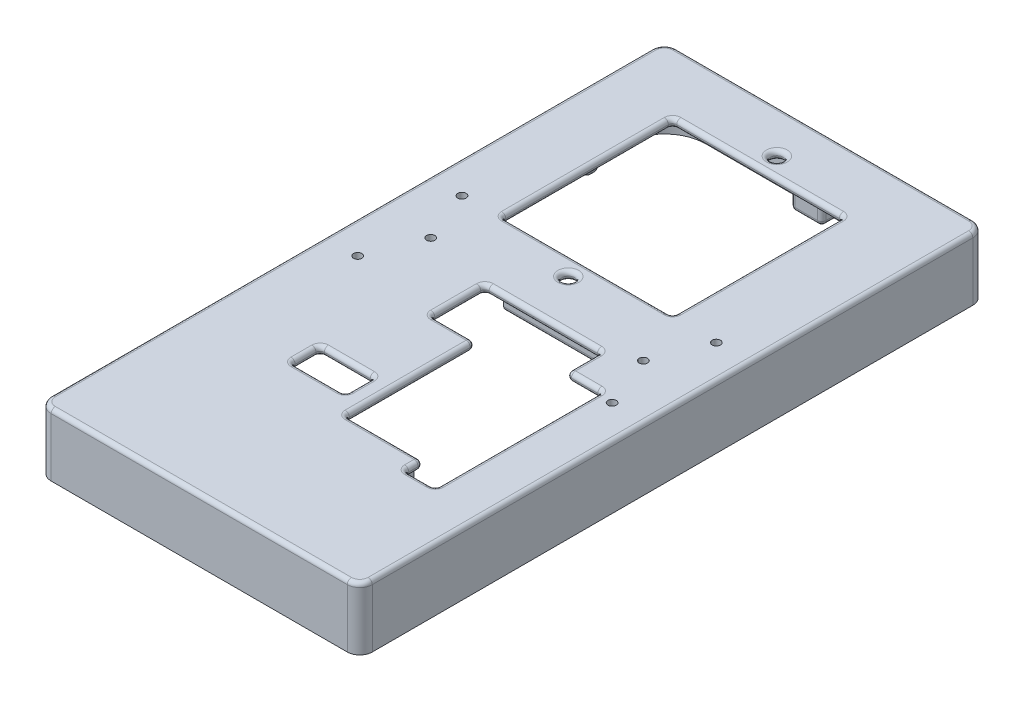
from build123d import *

# Parameters (mm, degrees)
EXTRUDE_1_DEPTH     = 15
FILLET_1_R          = 1
EXTRUDE_START       = -2
SKETCH_2_R          = 1.5
EXTRUDE_2_DEPTH     = 2
SKETCH_6_W          = 4.148468686
SKETCH_6_H          = 9
SKETCH_6_W_2        = 1
SKETCH_6_H_2        = 40
SKETCH_6_W_3        = 28
SKETCH_6_H_3        = 2.5
SKETCH_6_W_4        = 4.023279283
SKETCH_6_H_4        = 31
EXTRUDE_4_DEPTH     = 2
FILLET_7_R          = 1
CUT_EXTRUDE_3_DEPTH = 2
EXTRUDE_5_DEPTH     = 13
FILLET_2_R          = 1
FILLET_3_R          = 1
FILLET_4_R          = 1
SKETCH_3_R          = 0.95
CUT_EXTRUDE_1_DEPTH = 10
EXTRUDE_3_DEPTH     = 5
FILLET_6_R          = 1
SKETCH_5_R          = 1
CUT_EXTRUDE_2_DEPTH = 2
SKETCH_9_R          = 0.675
CUT_EXTRUDE_4_DEPTH = 10
FILLET_8_R          = 1


# Some blends are built 0.0001 mm under size
with BuildPart() as part:
    # 草图1 → 凸台-拉伸1 (new body)
    with BuildSketch(Plane(origin=(0, 0, 0), x_dir=(1, 0, 0), z_dir=(0, 1, 0))):
        with BuildLine():
            Line((-45.147424513, 1386.006364089), (-45.147424513, 1242.006364089))
            ThreePointArc((-45.147424513, 1242.006364089), (-46.02610417, 1239.885043746), (-48.147424513, 1239.006364089))
            Line((-48.147424513, 1239.006364089), (-119.147424513, 1239.006364089))
            ThreePointArc((-119.147424513, 1239.006364089), (-121.268744857, 1239.885043746), (-122.147424513, 1242.006364089))
            Line((-122.147424513, 1242.006364089), (-122.147424513, 1386.006364089))
            ThreePointArc((-122.147424513, 1386.006364089), (-121.268744857, 1388.127684433), (-119.147424513, 1389.006364089))
            Line((-119.147424513, 1389.006364089), (-48.147424513, 1389.006364089))
            ThreePointArc((-48.147424513, 1389.006364089), (-46.02610417, 1388.127684433), (-45.147424513, 1386.006364089))
        make_face()
        with BuildLine():
            Line((-110.647424513, 1387.506364089), (-86.803457574, 1387.506364089))
            Line((-86.803457574, 1387.506364089), (-86.803457574, 1384.006364089))
            Line((-86.803457574, 1384.006364089), (-79.369983761, 1384.006364089))
            Line((-79.369983761, 1384.006364089), (-79.369983761, 1387.506364089))
            Line((-79.369983761, 1387.506364089), (-56.647424513, 1387.506364089))
            ThreePointArc((-56.647424513, 1387.506364089), (-49.576356701, 1384.577431901), (-46.647424513, 1377.506364089))
            Line((-46.647424513, 1377.506364089), (-46.647424513, 1369.006364089))
            Line((-46.647424513, 1369.006364089), (-49.647424513, 1369.006364089))
            Line((-49.647424513, 1369.006364089), (-49.647424513, 1366.006364089))
            Line((-49.647424513, 1366.006364089), (-46.647424513, 1366.006364089))
            Line((-46.647424513, 1366.006364089), (-46.647424513, 1262.006364089))
            Line((-46.647424513, 1262.006364089), (-49.647424513, 1262.006364089))
            Line((-49.647424513, 1262.006364089), (-49.647424513, 1259.006364089))
            Line((-49.647424513, 1259.006364089), (-46.647424513, 1259.006364089))
            Line((-46.647424513, 1259.006364089), (-46.647424513, 1250.506364089))
            ThreePointArc((-46.647424513, 1250.506364089), (-49.576356701, 1243.435296277), (-56.647424513, 1240.506364089))
            Line((-56.647424513, 1240.506364089), (-80.788236334, 1240.506364089))
            Line((-80.788236334, 1240.506364089), (-80.788236334, 1243.506364089))
            Line((-80.788236334, 1243.506364089), (-86.803457574, 1243.506364089))
            Line((-86.803457574, 1243.506364089), (-86.803457574, 1240.506364089))
            Line((-86.803457574, 1240.506364089), (-110.647424513, 1240.506364089))
            ThreePointArc((-110.647424513, 1240.506364089), (-117.718492325, 1243.435296277), (-120.647424513, 1250.506364089))
            Line((-120.647424513, 1250.506364089), (-120.647424513, 1259.006364089))
            Line((-120.647424513, 1259.006364089), (-117.647424513, 1259.006364089))
            Line((-117.647424513, 1259.006364089), (-117.647424513, 1262.006364089))
            Line((-117.647424513, 1262.006364089), (-120.647424513, 1262.006364089))
            Line((-120.647424513, 1262.006364089), (-120.647424513, 1366.006364089))
            Line((-120.647424513, 1366.006364089), (-117.647424513, 1366.006364089))
            Line((-117.647424513, 1366.006364089), (-117.647424513, 1369.006364089))
            Line((-117.647424513, 1369.006364089), (-120.647424513, 1369.006364089))
            Line((-120.647424513, 1369.006364089), (-120.647424513, 1377.506364089))
            ThreePointArc((-120.647424513, 1377.506364089), (-117.718492325, 1384.577431901), (-110.647424513, 1387.506364089))
        make_face(mode=Mode.SUBTRACT)
    extrude(amount=EXTRUDE_1_DEPTH)

    # 圆角1
    fillet_1_edges = [part.edges().sort_by_distance(p)[0] for p in [
        (-49.647424513, 7.5, -1259.006364089),
        (-49.647424513, 7.5, -1262.006364089),
        (-49.647424513, 7.5, -1366.006364089),
        (-49.647424513, 7.5, -1369.006364089),
        (-79.369983761, 7.5, -1384.006364089),
        (-86.803457574, 7.5, -1384.006364089),
        (-117.647424513, 7.5, -1369.006364089),
        (-117.647424513, 7.5, -1366.006364089),
        (-117.647424513, 7.5, -1262.006364089),
        (-117.647424513, 7.5, -1259.006364089),
        (-86.803457574, 7.5, -1243.506364089),
        (-80.788236334, 7.5, -1243.506364089),
    ]]
    fillet(fillet_1_edges, radius=FILLET_1_R)

    # 草图2 → 凸台-拉伸2 (add)
    with BuildSketch(Plane(origin=(0, 15, 0), x_dir=(1, 0, 0), z_dir=(0, 1, 0)).offset(EXTRUDE_START)):
        with BuildLine():
            Line((-45.147424513, 1242.006364089), (-45.147424513, 1386.006364089))
            ThreePointArc((-45.147424513, 1386.006364089), (-46.02610417, 1388.127684433), (-48.147424513, 1389.006364089))
            Line((-48.147424513, 1389.006364089), (-119.147424513, 1389.006364089))
            ThreePointArc((-119.147424513, 1389.006364089), (-121.268744857, 1388.127684433), (-122.147424513, 1386.006364089))
            Line((-122.147424513, 1386.006364089), (-122.147424513, 1242.006364089))
            ThreePointArc((-122.147424513, 1242.006364089), (-121.268744857, 1239.885043746), (-119.147424513, 1239.006364089))
            Line((-119.147424513, 1239.006364089), (-48.147424513, 1239.006364089))
            ThreePointArc((-48.147424513, 1239.006364089), (-46.02610417, 1239.885043746), (-45.147424513, 1242.006364089))
        make_face()
        with Locations(Location((-84.647424513, 1378.506364089, 0), (0, 0, 270))):
            Circle(SKETCH_2_R, mode=Mode.SUBTRACT)
        with Locations(Location((-84.647424513, 1328.506364089, 0), (0, 0, 270))):
            Circle(SKETCH_2_R, mode=Mode.SUBTRACT)
        with BuildLine():
            Line((-65.147424513, 1308.756575121), (-65.147424513, 1318.506364089))
            ThreePointArc((-65.147424513, 1318.506364089), (-65.440317732, 1319.21347087), (-66.147424513, 1319.506364089))
            Line((-66.147424513, 1319.506364089), (-92.147424513, 1319.506364089))
            ThreePointArc((-92.147424513, 1319.506364089), (-92.854531294, 1319.21347087), (-93.147424513, 1318.506364089))
            Line((-93.147424513, 1318.506364089), (-93.147424513, 1313.006364089))
            ThreePointArc((-93.147424513, 1313.006364089), (-93.440317732, 1312.299257308), (-94.147424513, 1312.006364089))
            Line((-94.147424513, 1312.006364089), (-95.147424513, 1312.006364089))
            ThreePointArc((-95.147424513, 1312.006364089), (-95.854531294, 1311.71347087), (-96.147424513, 1311.006364089))
            Line((-96.147424513, 1311.006364089), (-96.147424513, 1305.006364089))
            ThreePointArc((-96.147424513, 1305.006364089), (-95.854531294, 1304.299257308), (-95.147424513, 1304.006364089))
            Line((-95.147424513, 1304.006364089), (-86.147424513, 1304.006364089))
            ThreePointArc((-86.147424513, 1304.006364089), (-85.440317732, 1303.71347087), (-85.147424513, 1303.006364089))
            Line((-85.147424513, 1303.006364089), (-85.147424513, 1274.006364089))
            ThreePointArc((-85.147424513, 1274.006364089), (-84.854531294, 1273.299257308), (-84.147424513, 1273.006364089))
            Line((-84.147424513, 1273.006364089), (-65.147424513, 1273.006364089))
            Line((-65.147424513, 1273.006364089), (-64.147424513, 1273.006364089))
            Line((-64.147424513, 1273.006364089), (-64.147424513, 1269.756575121))
            ThreePointArc((-64.147424513, 1269.756575121), (-63.854531294, 1269.04946834), (-63.147424513, 1268.756575121))
            Line((-63.147424513, 1268.756575121), (-56.817685319, 1268.756575121))
            ThreePointArc((-56.817685319, 1268.756575121), (-56.110578538, 1269.04946834), (-55.817685319, 1269.756575121))
            Line((-55.817685319, 1269.756575121), (-55.817685319, 1308.756575121))
            Line((-55.817685319, 1308.756575121), (-65.147424513, 1308.756575121))
        make_face(mode=Mode.SUBTRACT)
        with BuildLine():
            Line((-89.147424513, 1277.506364089), (-99.147424513, 1277.506364089))
            ThreePointArc((-99.147424513, 1277.506364089), (-99.854531294, 1277.799257308), (-100.147424513, 1278.506364089))
            Line((-100.147424513, 1278.506364089), (-100.147424513, 1283.506364089))
            ThreePointArc((-100.147424513, 1283.506364089), (-99.854531294, 1284.21347087), (-99.147424513, 1284.506364089))
            Line((-99.147424513, 1284.506364089), (-89.147424513, 1284.506364089))
            ThreePointArc((-89.147424513, 1284.506364089), (-88.440317732, 1284.21347087), (-88.147424513, 1283.506364089))
            Line((-88.147424513, 1283.506364089), (-88.147424513, 1278.506364089))
            ThreePointArc((-88.147424513, 1278.506364089), (-88.440317732, 1277.799257308), (-89.147424513, 1277.506364089))
        make_face(mode=Mode.SUBTRACT)
        with BuildLine():
            Line((-104.147424513, 1374.006364089), (-65.147424513, 1374.006364089))
            ThreePointArc((-65.147424513, 1374.006364089), (-64.440317732, 1373.71347087), (-64.147424513, 1373.006364089))
            Line((-64.147424513, 1373.006364089), (-64.147424513, 1334.006364089))
            ThreePointArc((-64.147424513, 1334.006364089), (-64.440317732, 1333.299257308), (-65.147424513, 1333.006364089))
            Line((-65.147424513, 1333.006364089), (-104.147424513, 1333.006364089))
            ThreePointArc((-104.147424513, 1333.006364089), (-104.854531294, 1333.299257308), (-105.147424513, 1334.006364089))
            Line((-105.147424513, 1334.006364089), (-105.147424513, 1373.006364089))
            ThreePointArc((-105.147424513, 1373.006364089), (-104.854531294, 1373.71347087), (-104.147424513, 1374.006364089))
        make_face(mode=Mode.SUBTRACT)
    extrude(amount=EXTRUDE_2_DEPTH)

    # 草图6 → 凸台-拉伸4 (add)
    with BuildSketch(Plane(origin=(0, 15, 0), x_dir=(1, 0, 0), z_dir=(0, 1, 0))):
        with Locations((-95.221658856, 1308.506364089)):
            Rectangle(SKETCH_6_W, SKETCH_6_H)
        with Locations((-56.317685319, 1288.756575121)):
            Rectangle(SKETCH_6_W_2, SKETCH_6_H_2)
        with Locations((-79.147424513, 1318.256364089)):
            Rectangle(SKETCH_6_W_3, SKETCH_6_H_3)
        with Locations((-84.659064155, 1288.506364089)):
            Rectangle(SKETCH_6_W_4, SKETCH_6_H_4)
    extrude(amount=-EXTRUDE_4_DEPTH)

    # 圆角7
    fillet_7_edges = [part.edges().sort_by_distance(p)[0] for p in [
        (-64.147424513, 14, -1273.006364089),
        (-65.147424513, 14, -1308.756575121),
        (-56.817685319, 14, -1268.756575121),
        (-93.147424513, 14, -1304.006364089),
        (-56.817685319, 14, -1308.756575121),
        (-93.147424513, 14, -1317.006364089),
        (-65.147424513, 14, -1317.006364089),
        (-82.647424513, 14, -1273.006364089),
        (-82.647424513, 14, -1304.006364089),
    ]]
    fillet(fillet_7_edges, radius=FILLET_7_R)

    # 草图7 → 切除-拉伸3 (cut)
    with BuildSketch(Plane(origin=(0, 15, 0), x_dir=(1, 0, 0), z_dir=(0, 1, 0))):
        with BuildLine():
            Line((-89.147424513, 1284.506364089), (-88.147424513, 1284.506364089))
            ThreePointArc((-88.147424513, 1284.506364089), (-87.440317732, 1284.21347087), (-87.147424513, 1283.506364089))
            Line((-87.147424513, 1283.506364089), (-87.147424513, 1278.506364089))
            ThreePointArc((-87.147424513, 1278.506364089), (-87.440317732, 1277.799257308), (-88.147424513, 1277.506364089))
            Line((-88.147424513, 1277.506364089), (-89.147424513, 1277.506364089))
            Line((-89.147424513, 1277.506364089), (-89.147424513, 1284.506364089))
        make_face()
    extrude(amount=-CUT_EXTRUDE_3_DEPTH, mode=Mode.SUBTRACT)

    # 草图8 → 凸台-拉伸5 (add)
    with BuildSketch(Plane.XZ.offset(-13)):
        with BuildLine():
            Line((-48.647424513, -1315.506364089), (-46.647424513, -1315.506364089))
            Line((-46.647424513, -1315.506364089), (-46.647424513, -1312.506364089))
            Line((-46.647424513, -1312.506364089), (-48.647424513, -1312.506364089))
            ThreePointArc((-48.647424513, -1312.506364089), (-49.354531294, -1312.799257308), (-49.647424513, -1313.506364089))
            Line((-49.647424513, -1313.506364089), (-49.647424513, -1314.506364089))
            ThreePointArc((-49.647424513, -1314.506364089), (-49.354531294, -1315.21347087), (-48.647424513, -1315.506364089))
        make_face()
        with BuildLine():
            Line((-120.647424513, -1312.506364089), (-118.647424513, -1312.506364089))
            ThreePointArc((-118.647424513, -1312.506364089), (-117.940317732, -1312.799257308), (-117.647424513, -1313.506364089))
            Line((-117.647424513, -1313.506364089), (-117.647424513, -1314.506364089))
            ThreePointArc((-117.647424513, -1314.506364089), (-117.940317732, -1315.21347087), (-118.647424513, -1315.506364089))
            Line((-118.647424513, -1315.506364089), (-120.647424513, -1315.506364089))
            Line((-120.647424513, -1315.506364089), (-120.647424513, -1312.506364089))
        make_face()
    extrude(amount=EXTRUDE_5_DEPTH)

    # 圆角2
    fillet_2_edges = [part.edges().sort_by_distance(p)[0] for p in [
        (-46.02610417, 15, -1388.127684433),
        (-83.647424513, 15, -1389.006364089),
        (-121.268744857, 15, -1388.127684433),
        (-122.147424513, 15, -1314.006364089),
        (-121.268744857, 15, -1239.885043746),
        (-83.647424513, 15, -1239.006364089),
        (-63.854531294, 15, -1269.04946834),
        (-60.482554916, 15, -1268.756575121),
        (-93.647424513, 15, -1277.506364089),
        (-99.854531294, 15, -1277.799257308),
        (-100.147424513, 15, -1281.006364089),
        (-99.854531294, 15, -1284.21347087),
        (-93.647424513, 15, -1284.506364089),
        (-64.440317732, 15, -1333.299257308),
        (-84.647424513, 15, -1333.006364089),
        (-104.854531294, 15, -1333.299257308),
        (-105.147424513, 15, -1353.506364089),
        (-104.854531294, 15, -1373.71347087),
        (-84.647424513, 15, -1374.006364089),
        (-64.440317732, 15, -1373.71347087),
        (-64.147424513, 15, -1353.506364089),
        (-84.647424513, 15, -1380.006364089),
        (-84.647424513, 15, -1330.006364089),
        (-46.02610417, 15, -1239.885043746),
        (-93.147424513, 15, -1310.506364089),
        (-79.147424513, 15, -1317.006364089),
        (-87.897424513, 15, -1304.006364089),
        (-82.647424513, 15, -1288.506364089),
        (-65.147424513, 15, -1312.881469605),
        (-60.982554916, 15, -1308.756575121),
        (-56.817685319, 15, -1288.756575121),
        (-64.147424513, 15, -1270.881469605),
        (-73.397424513, 15, -1273.006364089),
        (-92.854531294, 15, -1316.71347087),
        (-92.854531294, 15, -1304.299257308),
        (-82.354531294, 15, -1273.299257308),
        (-57.110578538, 15, -1269.04946834),
        (-57.110578538, 15, -1308.463681902),
        (-65.440317732, 15, -1316.71347087),
        (-87.440317732, 15, -1277.799257308),
        (-87.147424513, 15, -1281.006364089),
        (-87.440317732, 15, -1284.21347087),
        (-45.147424513, 15, -1314.006364089),
        (-64.854531294, 15, -1309.04946834),
        (-64.440317732, 15, -1272.71347087),
        (-82.940317732, 15, -1303.71347087),
    ]]
    fillet(fillet_2_edges, radius=FILLET_2_R)

    # 圆角3
    fillet_3_edges = [part.edges().sort_by_distance(p)[0] for p in [
        (-49.647424513, 0, -1260.506364089),
        (-47.647424513, 0, -1262.006364089),
        (-49.647424513, 0, -1367.506364089),
        (-47.647424513, 0, -1369.006364089),
        (-83.086720668, 0, -1384.006364089),
        (-86.803457574, 0, -1386.256364089),
        (-117.647424513, 0, -1367.506364089),
        (-119.647424513, 0, -1366.006364089),
        (-117.647424513, 0, -1260.506364089),
        (-119.647424513, 0, -1259.006364089),
        (-117.940317732, 0, -1368.71347087),
        (-117.940317732, 0, -1366.299257308),
        (-49.354531294, 0, -1368.71347087),
        (-49.354531294, 0, -1366.299257308),
        (-49.354531294, 0, -1261.71347087),
        (-49.354531294, 0, -1259.299257308),
        (-117.940317732, 0, -1261.71347087),
        (-117.940317732, 0, -1259.299257308),
        (-86.510564355, 0, -1384.299257308),
        (-79.66287698, 0, -1384.299257308),
        (-47.647424513, 0, -1259.006364089),
        (-47.647424513, 0, -1366.006364089),
        (-79.369983761, 0, -1386.256364089),
        (-119.647424513, 0, -1369.006364089),
        (-119.647424513, 0, -1262.006364089),
    ]]
    fillet(fillet_3_edges, radius=FILLET_3_R)

    # 圆角4
    fillet_4_edges = [part.edges().sort_by_distance(p)[0] for p in [
        (-73.397424513, 13, -1273.006364089),
        (-87.897424513, 13, -1304.006364089),
        (-93.147424513, 13, -1310.506364089),
        (-65.147424513, 13, -1312.881469605),
        (-93.647424513, 13, -1277.506364089),
        (-99.854531294, 13, -1277.799257308),
        (-100.147424513, 13, -1281.006364089),
        (-99.854531294, 13, -1284.21347087),
        (-93.647424513, 13, -1284.506364089),
        (-86.510564355, 13, -1243.21347087),
        (-83.795846954, 13, -1243.506364089),
        (-81.081129553, 13, -1243.21347087),
        (-80.788236334, 13, -1241.506364089),
        (-68.717830424, 13, -1240.506364089),
        (-49.576356701, 13, -1243.435296277),
        (-46.647424513, 13, -1254.756364089),
        (-47.647424513, 13, -1259.006364089),
        (-49.354531294, 13, -1259.299257308),
        (-49.647424513, 13, -1260.506364089),
        (-49.354531294, 13, -1261.71347087),
        (-47.647424513, 13, -1262.006364089),
        (-46.647424513, 13, -1287.256364089),
        (-46.647424513, 13, -1340.756364089),
        (-47.647424513, 13, -1366.006364089),
        (-49.354531294, 13, -1366.299257308),
        (-49.647424513, 13, -1367.506364089),
        (-49.354531294, 13, -1368.71347087),
        (-47.647424513, 13, -1369.006364089),
        (-46.647424513, 13, -1373.256364089),
        (-49.576356701, 13, -1384.577431901),
        (-68.008704137, 13, -1387.506364089),
        (-79.369983761, 13, -1386.256364089),
        (-79.66287698, 13, -1384.299257308),
        (-83.086720668, 13, -1384.006364089),
        (-86.510564355, 13, -1384.299257308),
        (-86.803457574, 13, -1386.256364089),
        (-98.725441044, 13, -1387.506364089),
        (-117.718492325, 13, -1384.577431901),
        (-120.647424513, 13, -1373.256364089),
        (-119.647424513, 13, -1369.006364089),
        (-117.940317732, 13, -1368.71347087),
        (-117.647424513, 13, -1367.506364089),
        (-117.940317732, 13, -1366.299257308),
        (-119.647424513, 13, -1366.006364089),
        (-120.647424513, 13, -1340.756364089),
        (-120.647424513, 13, -1287.256364089),
        (-119.647424513, 13, -1262.006364089),
        (-117.940317732, 13, -1261.71347087),
        (-117.647424513, 13, -1260.506364089),
        (-117.940317732, 13, -1259.299257308),
        (-119.647424513, 13, -1259.006364089),
        (-120.647424513, 13, -1254.756364089),
        (-117.718492325, 13, -1243.435296277),
        (-98.725441044, 13, -1240.506364089),
        (-86.803457574, 13, -1241.506364089),
        (-104.854531294, 13, -1333.299257308),
        (-105.147424513, 13, -1353.506364089),
        (-104.854531294, 13, -1373.71347087),
        (-84.647424513, 13, -1374.006364089),
        (-64.440317732, 13, -1373.71347087),
        (-64.147424513, 13, -1353.506364089),
        (-64.440317732, 13, -1333.299257308),
        (-84.647424513, 13, -1333.006364089),
        (-84.647424513, 13, -1380.006364089),
        (-84.647424513, 13, -1330.006364089),
        (-60.982554916, 13, -1308.756575121),
        (-60.482554916, 13, -1268.756575121),
        (-63.854531294, 13, -1269.04946834),
        (-64.147424513, 13, -1270.881469605),
        (-82.647424513, 13, -1288.506364089),
        (-79.147424513, 13, -1317.006364089),
        (-56.817685319, 13, -1288.756575121),
        (-87.147424513, 13, -1281.006364089),
        (-87.440317732, 13, -1277.799257308),
        (-87.440317732, 13, -1284.21347087),
        (-92.854531294, 13, -1304.299257308),
        (-92.854531294, 13, -1316.71347087),
        (-65.440317732, 13, -1316.71347087),
        (-64.854531294, 13, -1309.04946834),
        (-57.110578538, 13, -1308.463681902),
        (-57.110578538, 13, -1269.04946834),
        (-64.440317732, 13, -1272.71347087),
        (-82.354531294, 13, -1273.299257308),
        (-82.940317732, 13, -1303.71347087),
        (-47.647424513, 13, -1312.506364089),
        (-49.354531294, 13, -1312.799257308),
        (-49.647424513, 13, -1314.006364089),
        (-49.354531294, 13, -1315.21347087),
        (-47.647424513, 13, -1315.506364089),
        (-119.647424513, 13, -1315.506364089),
        (-117.940317732, 13, -1315.21347087),
        (-117.647424513, 13, -1314.006364089),
        (-117.940317732, 13, -1312.799257308),
        (-119.647424513, 13, -1312.506364089),
    ]]
    fillet(fillet_4_edges, radius=FILLET_4_R - 0.0001)  # a hair under: the kernel refuses the full size

    # 草图3 → 切除-拉伸1 (cut)
    with BuildSketch(Plane.XZ):
        with Locations(Location((-47.647424513, -1241.506364089, 0), (0, 0, 270))):
            Circle(SKETCH_3_R)
        with Locations(Location((-47.647424513, -1386.506364089, 0), (0, 0, 90))):
            Circle(SKETCH_3_R)
        with Locations(Location((-119.647424513, -1386.506364089, 0), (0, 0, 270))):
            Circle(SKETCH_3_R)
        with Locations(Location((-119.647424513, -1241.506364089, 0), (0, 0, 90))):
            Circle(SKETCH_3_R)
    extrude(amount=-CUT_EXTRUDE_1_DEPTH, mode=Mode.SUBTRACT)

    # 草图4 → 凸台-拉伸3 (add)
    with BuildSketch(Plane.XZ.offset(-13)):
        with BuildLine():
            Line((-65.147424513, -1272.006364089), (-84.189709335, -1272.006364089))
            Line((-84.189709335, -1272.006364089), (-84.189709335, -1270.363580133))
            ThreePointArc((-84.189709335, -1270.363580133), (-83.896816117, -1269.656473352), (-83.189709335, -1269.363580133))
            Line((-83.189709335, -1269.363580133), (-65.147424513, -1269.363580133))
            Line((-65.147424513, -1269.363580133), (-65.147424513, -1272.006364089))
        make_face()
        with BuildLine():
            Line((-92.147424513, -1320.506364089), (-66.038217179, -1320.506364089))
            Line((-66.038217179, -1320.506364089), (-66.038217179, -1323.506364089))
            ThreePointArc((-66.038217179, -1323.506364089), (-66.331110398, -1324.21347087), (-67.038217179, -1324.506364089))
            Line((-67.038217179, -1324.506364089), (-91.147424513, -1324.506364089))
            ThreePointArc((-91.147424513, -1324.506364089), (-91.854531294, -1324.21347087), (-92.147424513, -1323.506364089))
            Line((-92.147424513, -1323.506364089), (-92.147424513, -1320.506364089))
        make_face()
        with BuildLine():
            Line((-108.48607648, -1336.761605055), (-111.798345351, -1336.761605055))
            ThreePointArc((-111.798345351, -1336.761605055), (-112.505452132, -1336.468711836), (-112.798345351, -1335.761605055))
            Line((-112.798345351, -1335.761605055), (-112.798345351, -1333.761605055))
            ThreePointArc((-112.798345351, -1333.761605055), (-112.505452132, -1333.054498274), (-111.798345351, -1332.761605055))
            Line((-111.798345351, -1332.761605055), (-108.48607648, -1332.761605055))
            ThreePointArc((-108.48607648, -1332.761605055), (-107.778969698, -1333.054498274), (-107.48607648, -1333.761605055))
            Line((-107.48607648, -1333.761605055), (-107.48607648, -1335.761605055))
            ThreePointArc((-107.48607648, -1335.761605055), (-107.778969698, -1336.468711836), (-108.48607648, -1336.761605055))
        make_face()
    extrude(amount=EXTRUDE_3_DEPTH)

    # 圆角6
    fillet_6_edges = [part.edges().sort_by_distance(p)[0] for p in [
        (-92.147424513, 8, -1322.006364089),
        (-91.854531294, 8, -1324.21347087),
        (-79.092820846, 8, -1324.506364089),
        (-66.331110398, 8, -1324.21347087),
        (-66.038217179, 8, -1322.006364089),
        (-79.092820846, 8, -1320.506364089),
    ]]
    fillet(fillet_6_edges, radius=FILLET_6_R)

    # 草图5 → 切除-拉伸2 (cut)
    with BuildSketch(Plane(origin=(0, 15, 0), x_dir=(1, 0, 0), z_dir=(0, 1, 0))):
        with Locations(Location((-58.147424513, 1320.006364089, 0), (0, 0, 270))):
            Circle(SKETCH_5_R)
        with Locations(Location((-53.147424513, 1307.506364089, 0), (0, 0, 270))):
            Circle(SKETCH_5_R)
        with Locations(Location((-53.147424513, 1332.506364089, 0), (0, 0, 270))):
            Circle(SKETCH_5_R)
        with Locations(Location((-114.147424513, 1332.506364089, 0), (0, 0, 270))):
            Circle(SKETCH_5_R)
        with Locations(Location((-114.147424513, 1307.506364089, 0), (0, 0, 270))):
            Circle(SKETCH_5_R)
        with Locations(Location((-109.147424513, 1320.006364089, 0), (0, 0, 270))):
            Circle(SKETCH_5_R)
    extrude(amount=-CUT_EXTRUDE_2_DEPTH, mode=Mode.SUBTRACT)

    # 草图9 → 切除-拉伸4 (cut)
    with BuildSketch(Plane.XZ):
        with Locations(Location((-47.147424513, -1314.031879868, 0), (0, 0, 270))):
            Circle(SKETCH_9_R)
        with Locations(Location((-120.147424513, -1314.031879868, 0), (0, 0, 90))):
            Circle(SKETCH_9_R)
    extrude(amount=-CUT_EXTRUDE_4_DEPTH, mode=Mode.SUBTRACT)

    # 圆角8
    # the kernel refuses this fillet: 1 mm, written as the material it adds along each edge
    with BuildSketch(Plane(origin=(-47.647424513, 13, -1316.506364089), x_dir=(0, 0, 1), z_dir=(-1, 0, 0))) as fillet_8_piece_1:
        with BuildLine():
            CenterArc((0.0001, -0.9999), 0.9999, 0, 90)
            Line((1, -0.9999), (1, 0))
            Line((1, 0), (0.0001, 0))
        make_face()
    revolve(axis=Axis((-47.647424513, 13, -1316.506364089), (0, 1, 0)), revolution_arc=90)
    with BuildSketch(Plane(origin=(-47.647424513, 13, -1311.506364089), x_dir=(1, 0, 0), z_dir=(0, 0, 1))) as fillet_8_piece_2:
        with BuildLine():
            CenterArc((0.0001, -0.9999), 0.9999, 0, 90)
            Line((1, -0.9999), (1, 0))
            Line((1, 0), (0.0001, 0))
        make_face()
    revolve(axis=Axis((-47.647424513, 13, -1311.506364089), (0, 1, 0)), revolution_arc=90)
    with BuildSketch(Plane(origin=(-119.647424513, 13, -1316.506364089), x_dir=(-1, 0, 0), z_dir=(0, 0, -1))) as fillet_8_piece_3:
        with BuildLine():
            CenterArc((0.0001, -0.9999), 0.9999, 0, 90)
            Line((1, -0.9999), (1, 0))
            Line((1, 0), (0.0001, 0))
        make_face()
    revolve(axis=Axis((-119.647424513, 13, -1316.506364089), (0, 1, 0)), revolution_arc=90)
    with BuildSketch(Plane(origin=(-119.647424513, 13, -1311.506364089), x_dir=(0, 0, -1), z_dir=(1, 0, 0))) as fillet_8_piece_4:
        with BuildLine():
            CenterArc((0.0001, -0.9999), 0.9999, 0, 90)
            Line((1, -0.9999), (1, 0))
            Line((1, 0), (0.0001, 0))
        make_face()
    revolve(axis=Axis((-119.647424513, 13, -1311.506364089), (0, 1, 0)), revolution_arc=90)
    with BuildSketch(Plane(origin=(-46.647424513, 13, -1315.506364089), x_dir=(-1, 0, 0), z_dir=(0, -1, 0)), Plane(origin=(-46.647424513, 13, -1312.506364089), x_dir=(0, 0, 1), z_dir=(0, -1, 0))) as fillet_8_piece_5:
        with BuildLine():
            CenterArc((FILLET_8_R, FILLET_8_R), FILLET_8_R, 180, 90)
            Line((0, FILLET_8_R), (0, 0))
            Line((0, 0), (FILLET_8_R, 0))
        make_face()
    extrude(amount=13)
    with BuildSketch(Plane(origin=(-120.647424513, 13, -1312.506364089), x_dir=(0, 0, 1), z_dir=(0, -1, 0)), Plane(origin=(-120.647424513, 13, -1315.506364089), x_dir=(1, 0, 0), z_dir=(0, -1, 0))) as fillet_8_piece_6:
        with BuildLine():
            CenterArc((FILLET_8_R, -FILLET_8_R), FILLET_8_R, 90, 90)
            Line((0, -FILLET_8_R), (0, 0))
            Line((0, 0), (FILLET_8_R, 0))
        make_face()
    extrude(amount=13)


solid = part.part
